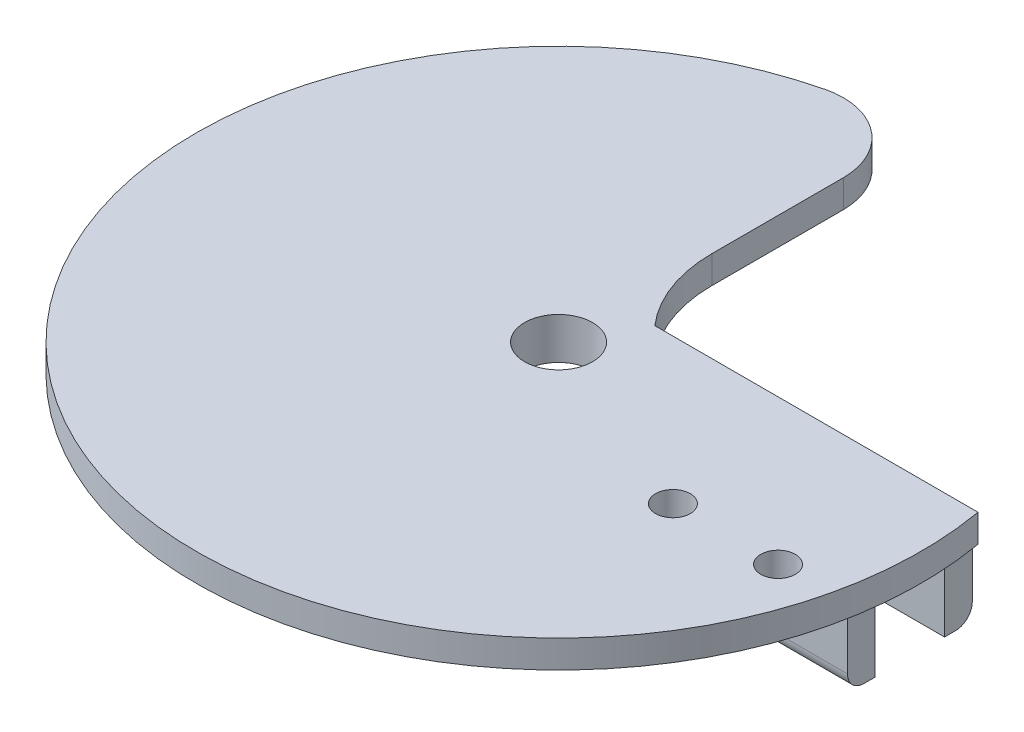
from build123d import *
from build123d.topology import SkipClean

# Parameters (mm, degrees)
SKETCH1_R                 = 1.25
SKETCH1_R_2               = 2.45
BOSS_EXTRUDE1_DEPTH       = 2
BOSS_EXTRUDE2_START       = -3
BOSS_EXTRUDE2_OUTLINE_R   = 4.9
BOSS_EXTRUDE2_OUTLINE_R_2 = 2.45
BOSS_EXTRUDE2_DEPTH       = 1
SKETCH1_5_W               = 13.43962311
SKETCH1_5_H               = 2
BOSS_EXTRUDE3_DEPTH       = 7
FILLET1_R                 = 10
FILLET2_R                 = 5
FILLET3_R                 = 1.2
FILLET4_R                 = 1.2


# Read off the part's stored shape, not the designer's step: Boss-Extrude2
with BuildPart() as part:
    # Sketch1 → Boss-Extrude1 (new body)
    with BuildSketch(Plane(origin=(0, 0, 0), x_dir=(1, 0, 0), z_dir=(0, 1, 0))):
        with BuildLine():
            ThreePointArc((1.939071943, 4.5), (0.989949494, 4.79895822), (0, 4.9))
            Line((0, 4.9), (0, 26.132651094))
            ThreePointArc((0, 26.132651094), (-16.812473395, -20.006403764), (25.742289199, 4.5))
            Line((25.742289199, 4.5), (1.939071943, 4.5))
        make_face()
        with Locations(Location((14.206057781, -5.961892897, 0), (0, 0, 270))):
            Circle(SKETCH1_R, mode=Mode.SUBTRACT)
        with Locations(Location((21.786269316, -5.961892897, 0), (0, 0, 270))):
            Circle(SKETCH1_R, mode=Mode.SUBTRACT)
        with Locations(Location((0, 0, 0), (0, 0, 270))):
            Circle(SKETCH1_R_2, mode=Mode.SUBTRACT)
    extrude(amount=-BOSS_EXTRUDE1_DEPTH)

    # Boss-Extrude2 outline → Boss-Extrude2 (add)
    with SkipClean():  # the faces are left unmerged after this step: merging them gives an invalid solid
        with BuildSketch(Plane(origin=(0, 0, 0), x_dir=(1, 0, 0), z_dir=(0, 1, 0)).offset(BOSS_EXTRUDE2_START)):
            Circle(BOSS_EXTRUDE2_OUTLINE_R)
            Circle(BOSS_EXTRUDE2_OUTLINE_R_2, mode=Mode.SUBTRACT)
        extrude(amount=BOSS_EXTRUDE2_DEPTH)
    add(part.part.scale(1), mode=Mode.REPLACE)  # the faces are merged on a copy

    # Sketch1<5> → Boss-Extrude3 (add)
    with BuildSketch(Plane(origin=(0, 0, 0), x_dir=(1, 0, 0), z_dir=(0, 1, 0))):
        with Locations((18.609497145, 3.5)):
            Rectangle(SKETCH1_5_W, SKETCH1_5_H)
        with Locations((18.609497145, -3.5)):
            Rectangle(SKETCH1_5_W, SKETCH1_5_H)
    extrude(amount=-BOSS_EXTRUDE3_DEPTH)

    # Fillet1
    # the kernel refuses this fillet: 10 mm, written as the material it adds along each edge
    with BuildSketch(Plane(origin=(0, 0, -4.9), x_dir=(0, 0, -1), z_dir=(0, -1, 0))) as fillet1_piece_1:
        with BuildLine():
            CenterArc((6.145813687, 10), FILLET1_R, 222.155184251, 47.844815749)
            ThreePointArc((-1.26748409, 3.288590604), (-0.32783815, 1.762196362), (0, 0))
            Line((0, 0), (6.145813687, 0))
        make_face()
    extrude(amount=2)

    # Fillet2
    fillet2_edges = [part.edges().sort_by_distance(p)[0] for p in [
        (0, -1, -26.132651094),
    ]]
    fillet(fillet2_edges, radius=FILLET2_R)

    # Fillet3
    fillet3_edges = [part.edges().sort_by_distance(p)[0] for p in [
        (18.609497145, -7, 4.5),
    ]]
    fillet(fillet3_edges, radius=FILLET3_R)

    # Fillet4
    fillet4_edges = [part.edges().sort_by_distance(p)[0] for p in [
        (18.609497145, -7, -4.5),
    ]]
    fillet(fillet4_edges, radius=FILLET4_R)


solid = part.part
